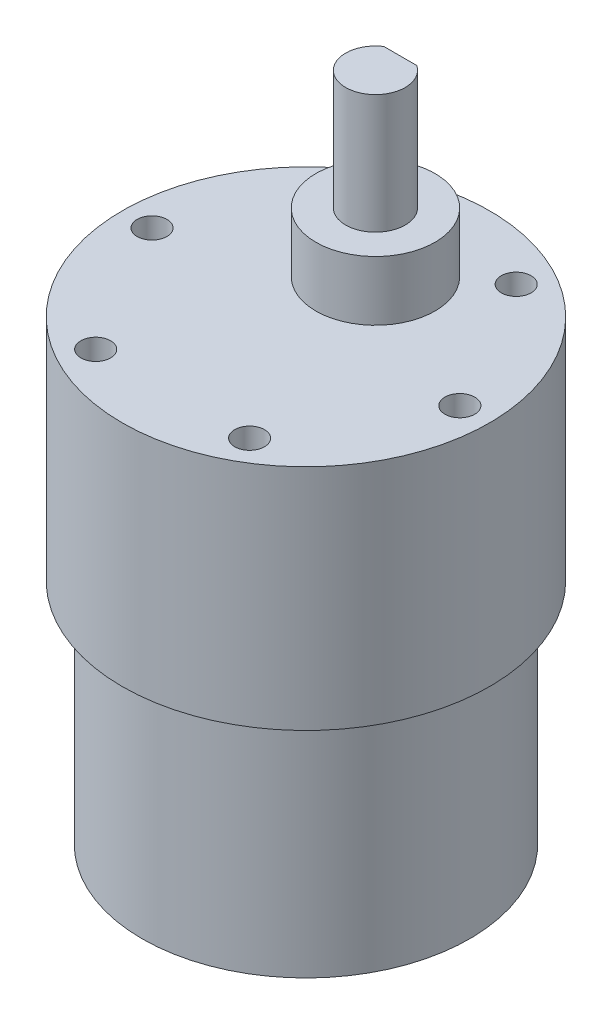
from build123d import *

# Parameters (mm, degrees)
SKETCH_1_R          = 16.5
EXTRUDE_1_DEPTH     = 23
SKETCH_1_3_R        = 18.5
EXTRUDE_2_DEPTH     = 23
SKETCH_3_R          = 1.5
CUT_EXTRUDE_1_DEPTH = 2.5
SKETCH_3_3_R        = 3
EXTRUDE_3_DEPTH     = 18
SKETCH_3_4_R        = 6
EXTRUDE_4_DEPTH     = 6
CUT_EXTRUDE_START   = -12
CUT_EXTRUDE_2_DEPTH = 12


with BuildPart() as part:
    # 草图1 → 凸台-拉伸1 (new body)
    with BuildSketch(Plane(origin=(0, 0, 0), x_dir=(1, 0, 0), z_dir=(0, 1, 0))):
        Circle(SKETCH_1_R)
    extrude(amount=-EXTRUDE_1_DEPTH)

    # 草图1<3> → 凸台-拉伸2 (add)
    with BuildSketch(Plane(origin=(0, 0, 0), x_dir=(1, 0, 0), z_dir=(0, 1, 0))):
        Circle(SKETCH_1_3_R)
    extrude(amount=EXTRUDE_2_DEPTH)

    # 草图3 → 切除-拉伸1 (cut)
    with BuildSketch(Plane(origin=(0, 23, 0), x_dir=(1, 0, 0), z_dir=(0, 1, 0))):
        with Locations((-7.75, 13.423393759)):
            Circle(SKETCH_3_R)
        with Locations((7.75, 13.423393759)):
            Circle(SKETCH_3_R)
        with Locations((15.5, 0)):
            Circle(SKETCH_3_R)
        with Locations((7.75, -13.423393759)):
            Circle(SKETCH_3_R)
        with Locations((-7.75, -13.423393759)):
            Circle(SKETCH_3_R)
        with Locations((-15.5, 0)):
            Circle(SKETCH_3_R)
    extrude(amount=-CUT_EXTRUDE_1_DEPTH, mode=Mode.SUBTRACT)

    # 草图3<3> → 凸台-拉伸3 (add)
    with BuildSketch(Plane(origin=(0, 23, 0), x_dir=(1, 0, 0), z_dir=(0, 1, 0))):
        with Locations((0, 7)):
            Circle(SKETCH_3_3_R)
    extrude(amount=EXTRUDE_3_DEPTH)

    # 草图3<4> → 凸台-拉伸4 (add)
    with BuildSketch(Plane(origin=(0, 23, 0), x_dir=(1, 0, 0), z_dir=(0, 1, 0))):
        with Locations((0, 7)):
            Circle(SKETCH_3_4_R)
    extrude(amount=EXTRUDE_4_DEPTH)

    # 草图4 → 切除-拉伸2 (cut)
    with BuildSketch(Plane(origin=(0, 41, 0), x_dir=(1, 0, 0), z_dir=(0, 1, 0)).offset(CUT_EXTRUDE_START)):
        with BuildLine():
            Line((-1.658312395, 9.5), (1.658312395, 9.5))
            ThreePointArc((1.658312395, 9.5), (0, 10), (-1.658312395, 9.5))
        make_face()
    extrude(amount=CUT_EXTRUDE_2_DEPTH, mode=Mode.SUBTRACT)


solid = part.part
